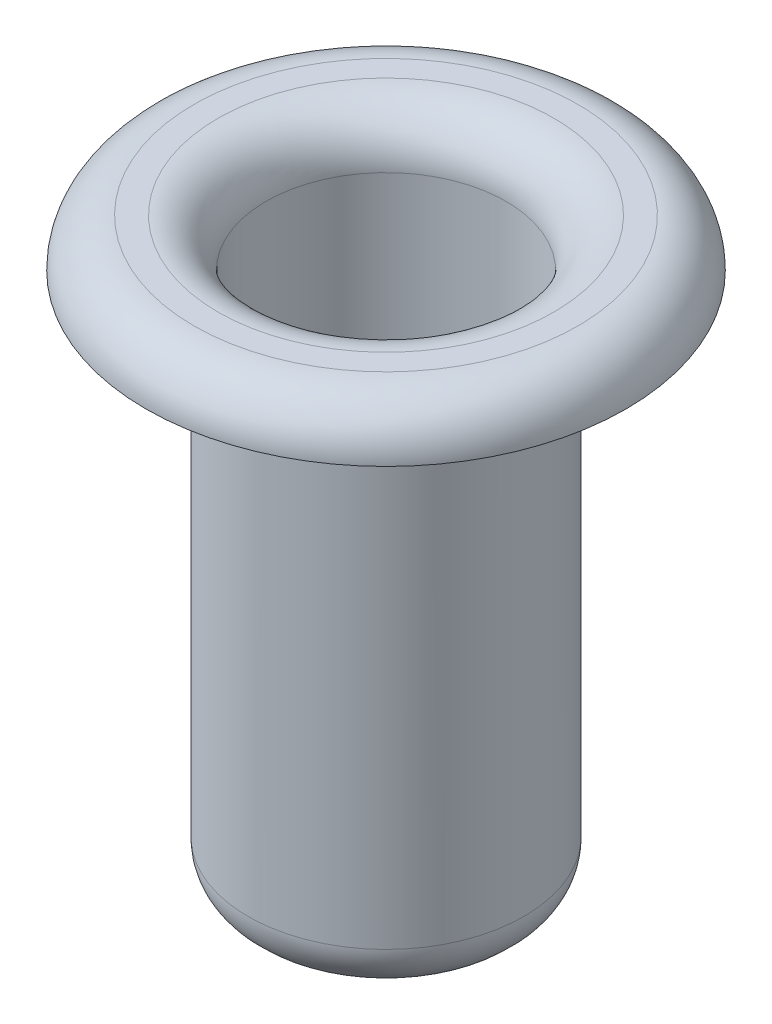
from build123d import *

# Parameters (mm, degrees)
SKETCH1_R           = 1.4605
BOSS_EXTRUDE1_DEPTH = 5.588
SKETCH2_R           = 2.54
BOSS_EXTRUDE2_DEPTH = 0.508
SKETCH3_R           = 1.27
CUT_EXTRUDE1_DEPTH  = 8.075621245
FILLET1_R           = 0.508


with BuildPart() as part:
    # Sketch1 → Boss-Extrude1 (new body)
    with BuildSketch(Plane(origin=(0, 0, 0), x_dir=(1, 0, 0), z_dir=(0, 1, 0))):
        with Locations(Location((0, 0, 0), (0, 0, 270))):
            Circle(SKETCH1_R)
    extrude(amount=BOSS_EXTRUDE1_DEPTH)

    # Sketch2 → Boss-Extrude2 (add)
    with BuildSketch(Plane(origin=(0, 5.588, 0), x_dir=(1, 0, 0), z_dir=(0, 1, 0))):
        with Locations(Location((0, 0, 0), (0, 0, 270))):
            Circle(SKETCH2_R)
    extrude(amount=BOSS_EXTRUDE2_DEPTH)

    # Sketch3 → Cut-Extrude1 (cut, through all)
    with BuildSketch(Plane(origin=(0, 6.096, 0), x_dir=(1, 0, 0), z_dir=(0, 1, 0))):
        with Locations(Location((0, 0, 0), (0, 0, 270))):
            Circle(SKETCH3_R)
    extrude(amount=-CUT_EXTRUDE1_DEPTH, mode=Mode.SUBTRACT)

    # Fillet1
    # the kernel refuses this fillet: 0.508 mm, written as the material it takes off along each edge
    with BuildSketch(Plane(origin=(0, 6.096, 0), x_dir=(0, 0, 1), z_dir=(-1, 0, 0))) as fillet1_piece_1:
        with BuildLine():
            CenterArc((1.27 + FILLET1_R, -FILLET1_R), FILLET1_R, 90, 90)
            Line((1.27, -FILLET1_R), (1.27 - FILLET1_R * 0.02, -FILLET1_R))
            Line((1.27 - FILLET1_R * 0.02, -FILLET1_R), (1.27 - FILLET1_R * 0.02, FILLET1_R * 0.02))
            Line((1.27 - FILLET1_R * 0.02, FILLET1_R * 0.02), (1.27 + FILLET1_R, FILLET1_R * 0.02))
            Line((1.27 + FILLET1_R, FILLET1_R * 0.02), (1.27 + FILLET1_R, 0))
        make_face()
    revolve(axis=Axis((0, 6.096, 0), (0, 1, 0)), mode=Mode.SUBTRACT)
    with BuildSketch(Plane(origin=(0, 0, 0), x_dir=(0, 0, 1), z_dir=(-1, 0, 0))) as fillet1_piece_2:
        with BuildLine():
            CenterArc((0.9525, 0.396557373), FILLET1_R, 308.682187453, 51.317812547)
            Line((1.27, 0), (1.27635, -0.007931147))
            ThreePointArc((1.27635, -0.007931147), (1.36525, -0.01016), (1.4605, -0.01016))
            Line((1.4605, -0.01016), (1.47066, 0))
            Line((1.47066, 0), (1.47066, 0.396557373))
            Line((1.47066, 0.396557373), (1.4605, 0.396557373))
        make_face()
    revolve(axis=Axis((0, 0, 0), (0, 1, 0)), mode=Mode.SUBTRACT)
    with BuildSketch(Plane(origin=(0, 6.096, 0), x_dir=(0, 0, 1), z_dir=(-1, 0, 0))) as fillet1_piece_3:
        with BuildLine():
            CenterArc((2.54 - FILLET1_R, -FILLET1_R), FILLET1_R, 0, 90)
            Line((2.54 - FILLET1_R, 0), (2.54 - FILLET1_R, FILLET1_R * 0.02))
            Line((2.54 - FILLET1_R, FILLET1_R * 0.02), (2.54 + FILLET1_R * 0.02, FILLET1_R * 0.02))
            Line((2.54 + FILLET1_R * 0.02, FILLET1_R * 0.02), (2.54 + FILLET1_R * 0.02, -FILLET1_R))
            Line((2.54 + FILLET1_R * 0.02, -FILLET1_R), (2.54, -FILLET1_R))
        make_face()
    revolve(axis=Axis((0, 6.096, 0), (0, 1, 0)), mode=Mode.SUBTRACT)


solid = part.part
